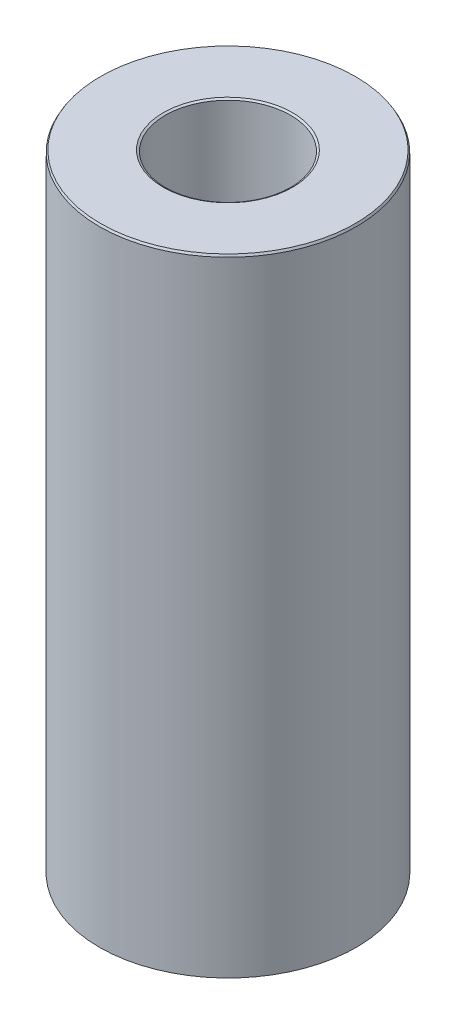
from build123d import *
from OCP.BRepFilletAPI import BRepFilletAPI_MakeChamfer

# Parameters (mm, degrees)
SKETCH1_R           = 50
BOSS_EXTRUDE1_DEPTH = 244.012405666
SKETCH2_R           = 24.358911927
CUT_EXTRUDE1_DEPTH  = 255.051282458
CHAMFER1_SIZE       = 0.798170043
CHAMFER1_SIZE2      = 0.460823689


with BuildPart() as part:
    # Sketch1 → Boss-Extrude1 (new body)
    with BuildSketch(Plane(origin=(0, 0, 0), x_dir=(1, 0, 0), z_dir=(0, 1, 0))):
        Circle(SKETCH1_R)
    extrude(amount=BOSS_EXTRUDE1_DEPTH)

    # Sketch2 → Cut-Extrude1 (cut, through all)
    with BuildSketch(Plane(origin=(0, 0, 0), x_dir=(1, 0, 0), z_dir=(0, 1, 0))):
        Circle(SKETCH2_R)
    extrude(amount=CUT_EXTRUDE1_DEPTH, mode=Mode.SUBTRACT)

    # Chamfer1: one chamfer whose edges measure the first distance from different faces: ONE call of the kernel's chamfer builder (chamfer() names one face for all edges)
    chamfer1_edges_1 = [part.edges().sort_by_distance(p)[0] for p in [
        (-24.358911927, 244.012405666, 0),
    ]]
    chamfer1_side_1 = [part.faces().sort_by_distance(p)[0] for p in [
        (-48.585786438, 244.012405666, 0),
    ]]
    chamfer1_edges_2 = [part.edges().sort_by_distance(p)[0] for p in [
        (-24.358911927, 0, 0),
    ]]
    chamfer1_side_2 = [part.faces().sort_by_distance(p)[0] for p in [
        (-24.358911927, 122.006202833, 0),
    ]]
    chamfer1_edges_3 = [part.edges().sort_by_distance(p)[0] for p in [
        (-50, 0, 0),
    ]]
    chamfer1_side_3 = [part.faces().sort_by_distance(p)[0] for p in [
        (-48.585786438, 0, 0),
    ]]
    chamfer1_edges_4 = [part.edges().sort_by_distance(p)[0] for p in [
        (-50, 244.012405666, 0),
    ]]
    chamfer1_side_4 = [part.faces().sort_by_distance(p)[0] for p in [
        (-50, 122.006202833, 0),
    ]]
    chamfer1 = BRepFilletAPI_MakeChamfer(part.part.solid().wrapped)
    for e in chamfer1_edges_1:
        chamfer1.Add(CHAMFER1_SIZE, CHAMFER1_SIZE2, e.wrapped, chamfer1_side_1[0].wrapped)  # the first distance lies on this face
    for e in chamfer1_edges_2:
        chamfer1.Add(CHAMFER1_SIZE, CHAMFER1_SIZE2, e.wrapped, chamfer1_side_2[0].wrapped)  # the first distance lies on this face
    for e in chamfer1_edges_3:
        chamfer1.Add(CHAMFER1_SIZE, CHAMFER1_SIZE2, e.wrapped, chamfer1_side_3[0].wrapped)  # the first distance lies on this face
    for e in chamfer1_edges_4:
        chamfer1.Add(CHAMFER1_SIZE, CHAMFER1_SIZE2, e.wrapped, chamfer1_side_4[0].wrapped)  # the first distance lies on this face
    add(Compound.cast(chamfer1.Shape()), mode=Mode.REPLACE)


solid = part.part
